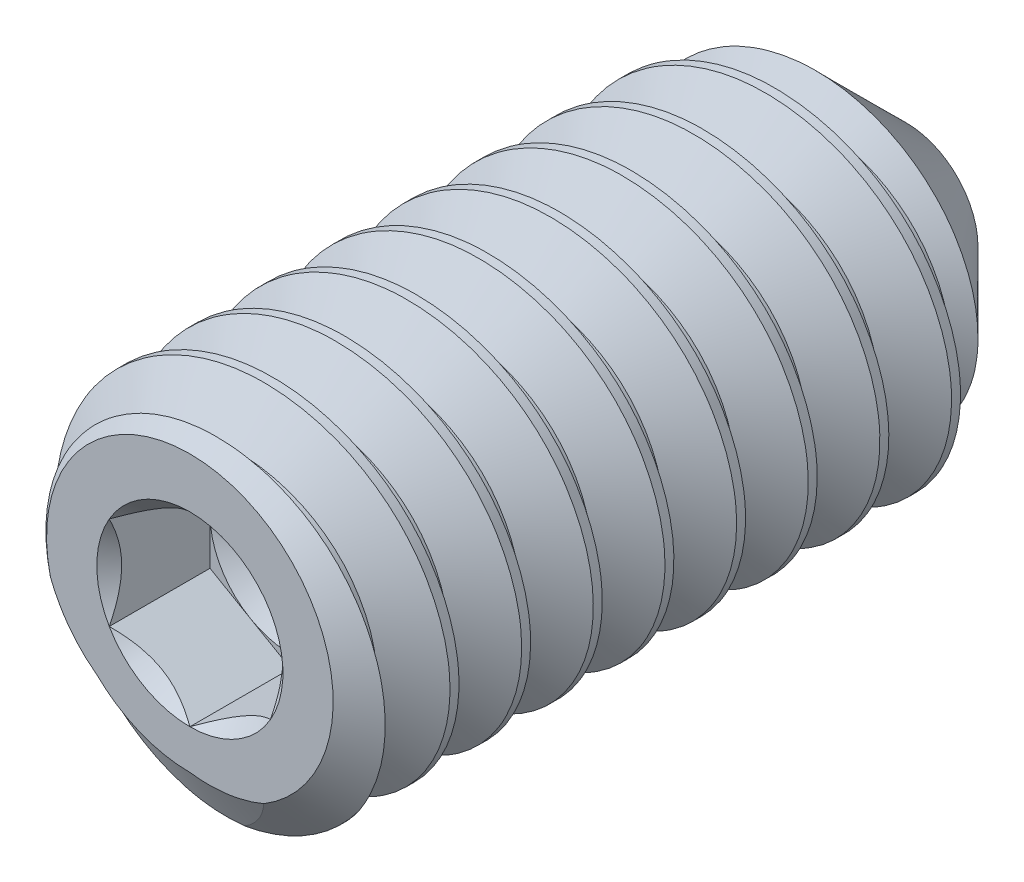
from build123d import *

# Parameters (mm, degrees)
CUT_EXTRUDE1_DEPTH = 0.5625
CUT_SWEEP1_PITCH   = 0.4


with BuildPart() as part:
    # Sketch11 → Revolve1 (revolve)
    with BuildSketch(Plane(origin=(0, 0, 0), x_dir=(0, 0, -1), z_dir=(1, 0, 0)), mode=Mode.PRIVATE) as revolve1_sk:
        Polygon((-2, 0), (-2, 0.8), (-1.859958492, 1), (1.4, 1), (2, 0.4), (1.759655752, 0), align=None)
    revolve(revolve1_sk.sketch.rotate(Axis((0, 0, -1.759655752), (0, 0, -1)), 180), axis=Axis((0, 0, -1.759655752), (0, 0, -1)))

    # Sketch2 → Cut-Extrude1 (cut)
    with BuildSketch(Plane.XY.offset(2)):
        Polygon((0, 0.519615242), (-0.45, 0.259807621), (-0.45, -0.259807621), (0, -0.519615242), (0.45, -0.259807621), (0.45, 0.259807621), align=None)
    extrude(amount=-CUT_EXTRUDE1_DEPTH, mode=Mode.SUBTRACT)

    # Cut-Extrude2 cone 1 section (through the dimple's axis) → Cut-Extrude2 (revolve, cut)
    with BuildSketch(Plane(origin=(0, 0, 2), x_dir=(0, -1, 0), z_dir=(1, 0, 0))):
        Polygon((0, 0), (0.519615242, 0), (0, 0.519615242), align=None)
    revolve(axis=Axis((0, 0, 2), (0, 0, -1)), mode=Mode.SUBTRACT)

    # Cut-Extrude3 cone 1 section (through the dimple's axis) → Cut-Extrude3 (revolve, cut)
    with BuildSketch(Plane(origin=(0, 0, 1.4375), x_dir=(0, -1, 0), z_dir=(1, 0, 0))):
        Polygon((0, 0), (0.45, 0), (0, 0.259807621), align=None)
    revolve(axis=Axis((0, 0, 1.4375), (0, 0, -1)), mode=Mode.SUBTRACT)

    # Cut-Sweep1: the profile of Sketch6 screwed along a right-hand helix of 11 turns, 6 arcs to a turn; built about Z, then put on its axis
    cut_sweep1_z = Axis((0, 0, 0), (0, 0, 1))
    cut_sweep1_corners = [(1.021650635, 0, 0.0125), (1.021650635, 0, -0.3625), (0.740192379, 0, -0.2), (0.740192379, 0, -0.15)]
    with BuildLine(mode=Mode.PRIVATE) as cut_sweep1_profile:
        Line(cut_sweep1_corners[0], cut_sweep1_corners[1])
        Line(cut_sweep1_corners[1], cut_sweep1_corners[2])
        Line(cut_sweep1_corners[2], cut_sweep1_corners[3])
        Line(cut_sweep1_corners[3], cut_sweep1_corners[0])
    cut_sweep1_cap = Face(cut_sweep1_profile.wire())
    cut_sweep1_turn_angles = [0, 30, 60, 90, 120, 150, 180, 210, 240, 270, 300, 330, 360]
    cut_sweep1_turn_weights = [1, 0.8660254037844387, 1, 0.8660254037844387, 1, 0.8660254037844387, 1, 0.8660254037844387, 1, 0.8660254037844387, 1, 0.8660254037844387, 1]
    cut_sweep1_turn_rails = [Edge.make_bspline([Vector(p[0], p[1], 0).rotate(cut_sweep1_z, cut_sweep1_turn_angles[k]) / cut_sweep1_turn_weights[k] + Vector(0, 0, p[2] + CUT_SWEEP1_PITCH * cut_sweep1_turn_angles[k] / 360) for k in range(13)], [0, 0, 0, 1, 1, 2, 2, 3, 3, 4, 4, 5, 5, 6, 6, 6], 2, cut_sweep1_turn_weights) for p in cut_sweep1_corners]
    cut_sweep1_turn_sides = [Face.make_surface_from_curves(cut_sweep1_turn_rails[p[0]], cut_sweep1_turn_rails[p[1]]) for p in [(0, 1), (1, 2), (2, 3), (3, 0)]]
    cut_sweep1 = Plane(origin=(0, 0, -2), x_dir=(0, 1, 0), z_dir=(0, 0, 1)) * Solid(Shell([*[p.moved(Location((0, 0, CUT_SWEEP1_PITCH * i))) for i in range(11) for p in cut_sweep1_turn_sides], cut_sweep1_cap, cut_sweep1_cap.rotate(cut_sweep1_z, 3960).moved(Location((0, 0, CUT_SWEEP1_PITCH * 3960 / 360)))]))
    add(cut_sweep1, mode=Mode.SUBTRACT)


solid = part.part
